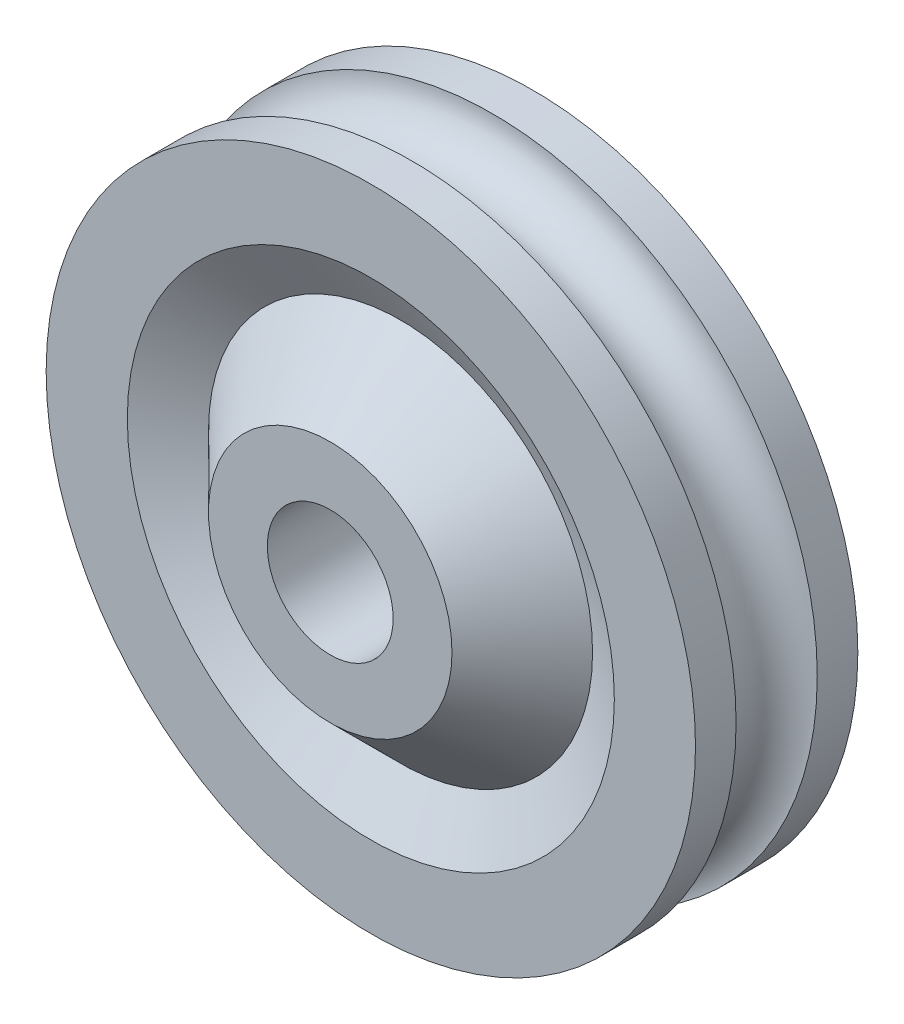
from build123d import *

# Parameters (mm, degrees)
SKETCH2_W          = 3
SKETCH2_H          = 1
SKETCH3_R          = 1.55
CUT_EXTRUDE1_DEPTH = 13.369316877
CHAMFER1_SIZE      = 2


with BuildPart() as part:
    # Sketch2 → Revolve1 (revolve)
    with BuildSketch(Plane(origin=(0, 0, 0), x_dir=(1, 0, 0), z_dir=(0, 1, 0))):
        with Locations((1.5, -2.5)):
            Rectangle(SKETCH2_W, SKETCH2_H)
        with BuildLine():
            Line((0, 2), (0, -2))
            Line((0, -2), (3, -2))
            Line((3, -2), (3, -1))
            Line((3, -1), (4.267949192, -1))
            Line((4.267949192, -1), (6, -2))
            Line((6, -2), (8, -2))
            Line((8, -2), (8, -1))
            ThreePointArc((8, -1), (7, 0), (8, 1))
            Line((8, 1), (8, 2))
            Line((8, 2), (0, 2))
        make_face()
    revolve(axis=Axis((0, 0, 2), (0, 0, -1)))

    # Sketch3 → Cut-Extrude1 (cut, through all)
    with BuildSketch(Plane.XY.offset(3)):
        Circle(SKETCH3_R)
    extrude(amount=-CUT_EXTRUDE1_DEPTH, mode=Mode.SUBTRACT)

    # Chamfer1
    # the kernel refuses this chamfer: 2 mm, written as the material it adds along each edge
    with BuildSketch(Plane(origin=(0, 0, 1), x_dir=(1, 0, 0), z_dir=(0, 1, 0))) as chamfer1_piece_1_section:
        Polygon((3, -CHAMFER1_SIZE), (3 + CHAMFER1_SIZE, 0), (3, 0), align=None)
    chamfer1_piece_1 = revolve(axis=Axis((0, 0, 1), (0, 0, -1)), mode=Mode.PRIVATE)
    chamfer1_piece_1 = split(chamfer1_piece_1, bisect_by=Plane(origin=(-4.002141123, 0, 3), z_dir=(0, 0, -1)), keep=Keep.TOP, mode=Mode.PRIVATE)
    add(chamfer1_piece_1)


solid = part.part
